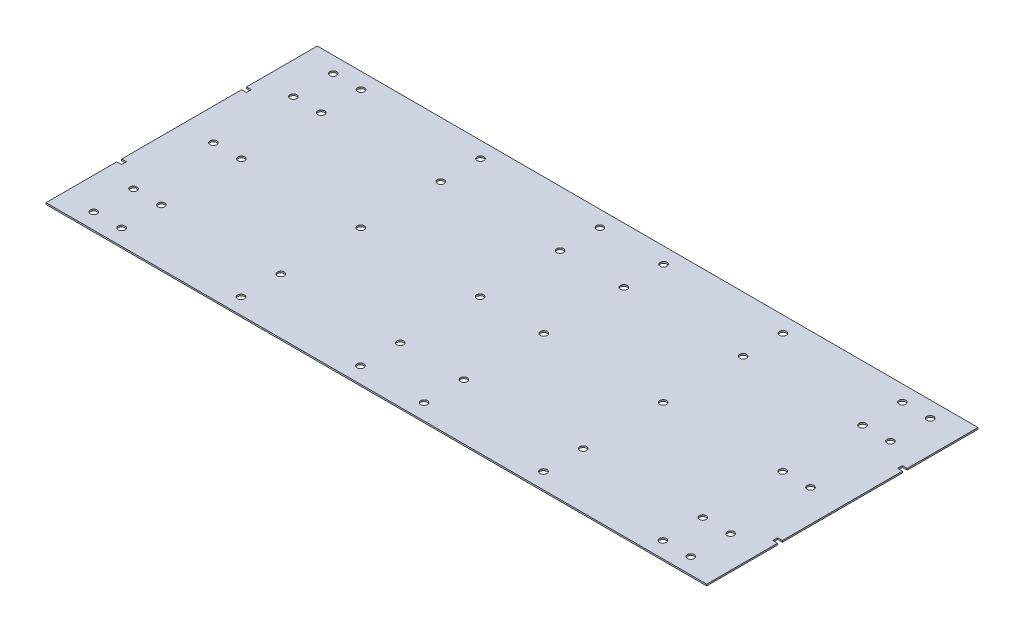
from build123d import *

# Parameters (mm, degrees)
SKETCH1_R           = 2.15
BOSS_EXTRUDE1_DEPTH = 1


with BuildPart() as part:
    # Sketch1 → Boss-Extrude1 (new body)
    with BuildSketch(Plane(origin=(0, 0, 0), x_dir=(1, 0, 0), z_dir=(0, 1, 0))):
        Polygon((-184.5, -40.7), (-187.5, -40.7), (-187.5, -85.2), (227.5, -85.2), (227.5, -40.7), (224.5, -40.7), (224.5, -37.7), (227.5, -37.7), (227.5, 37.7), (224.5, 37.7), (224.5, 40.7), (227.5, 40.7), (227.5, 85.2), (-187.5, 85.2), (-187.5, 40.7), (-184.5, 40.7), (-184.5, 37.7), (-187.5, 37.7), (-187.5, -37.7), (-184.5, -37.7), align=None)
        with Locations((-167.5, -75.2)):
            Circle(SKETCH1_R, mode=Mode.SUBTRACT)
        with Locations((-150, -75.2)):
            Circle(SKETCH1_R, mode=Mode.SUBTRACT)
        with Locations((-167.5, -50.2)):
            Circle(SKETCH1_R, mode=Mode.SUBTRACT)
        with Locations((-150, -50.2)):
            Circle(SKETCH1_R, mode=Mode.SUBTRACT)
        with Locations((-75, -75.2)):
            Circle(SKETCH1_R, mode=Mode.SUBTRACT)
        with Locations((0, -75.2)):
            Circle(SKETCH1_R, mode=Mode.SUBTRACT)
        with Locations((-75, -50.2)):
            Circle(SKETCH1_R, mode=Mode.SUBTRACT)
        with Locations((0, -50.2)):
            Circle(SKETCH1_R, mode=Mode.SUBTRACT)
        with Locations((-167.5, 0)):
            Circle(SKETCH1_R, mode=Mode.SUBTRACT)
        with Locations((-150, 0)):
            Circle(SKETCH1_R, mode=Mode.SUBTRACT)
        with Locations((-75, 0)):
            Circle(SKETCH1_R, mode=Mode.SUBTRACT)
        Circle(SKETCH1_R, mode=Mode.SUBTRACT)
        with Locations((40, -75.2)):
            Circle(SKETCH1_R, mode=Mode.SUBTRACT)
        with Locations((115, -75.2)):
            Circle(SKETCH1_R, mode=Mode.SUBTRACT)
        with Locations((40, -50.2)):
            Circle(SKETCH1_R, mode=Mode.SUBTRACT)
        with Locations((115, -50.2)):
            Circle(SKETCH1_R, mode=Mode.SUBTRACT)
        with Locations((190, -75.2)):
            Circle(SKETCH1_R, mode=Mode.SUBTRACT)
        with Locations((207.5, -75.2)):
            Circle(SKETCH1_R, mode=Mode.SUBTRACT)
        with Locations((190, -50.2)):
            Circle(SKETCH1_R, mode=Mode.SUBTRACT)
        with Locations((207.5, -50.2)):
            Circle(SKETCH1_R, mode=Mode.SUBTRACT)
        with Locations((40, 0)):
            Circle(SKETCH1_R, mode=Mode.SUBTRACT)
        with Locations((115, 0)):
            Circle(SKETCH1_R, mode=Mode.SUBTRACT)
        with Locations((190, 0)):
            Circle(SKETCH1_R, mode=Mode.SUBTRACT)
        with Locations((207.5, 0)):
            Circle(SKETCH1_R, mode=Mode.SUBTRACT)
        with Locations((-167.5, 50.2)):
            Circle(SKETCH1_R, mode=Mode.SUBTRACT)
        with Locations((-150, 50.2)):
            Circle(SKETCH1_R, mode=Mode.SUBTRACT)
        with Locations((-167.5, 75.2)):
            Circle(SKETCH1_R, mode=Mode.SUBTRACT)
        with Locations((-150, 75.2)):
            Circle(SKETCH1_R, mode=Mode.SUBTRACT)
        with Locations((-75, 50.2)):
            Circle(SKETCH1_R, mode=Mode.SUBTRACT)
        with Locations((0, 50.2)):
            Circle(SKETCH1_R, mode=Mode.SUBTRACT)
        with Locations((-75, 75.2)):
            Circle(SKETCH1_R, mode=Mode.SUBTRACT)
        with Locations((0, 75.2)):
            Circle(SKETCH1_R, mode=Mode.SUBTRACT)
        with Locations((40, 50.2)):
            Circle(SKETCH1_R, mode=Mode.SUBTRACT)
        with Locations((115, 50.2)):
            Circle(SKETCH1_R, mode=Mode.SUBTRACT)
        with Locations((40, 75.2)):
            Circle(SKETCH1_R, mode=Mode.SUBTRACT)
        with Locations((115, 75.2)):
            Circle(SKETCH1_R, mode=Mode.SUBTRACT)
        with Locations((190, 50.2)):
            Circle(SKETCH1_R, mode=Mode.SUBTRACT)
        with Locations((207.5, 50.2)):
            Circle(SKETCH1_R, mode=Mode.SUBTRACT)
        with Locations((190, 75.2)):
            Circle(SKETCH1_R, mode=Mode.SUBTRACT)
        with Locations((207.5, 75.2)):
            Circle(SKETCH1_R, mode=Mode.SUBTRACT)
    extrude(amount=BOSS_EXTRUDE1_DEPTH)


solid = part.part
